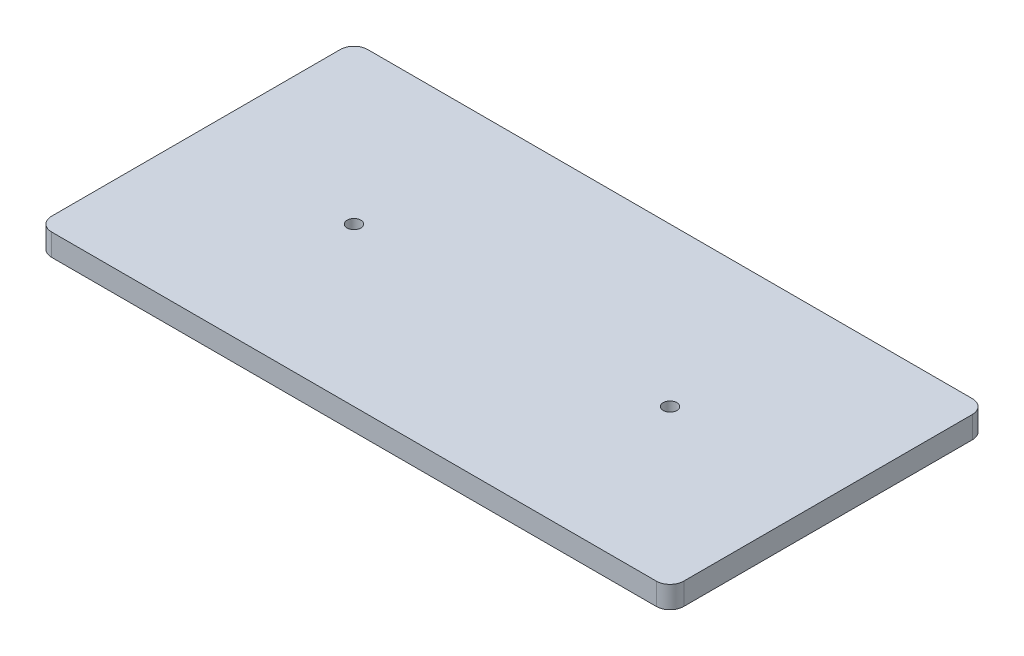
from build123d import *

# Parameters (mm, degrees)
EXTRUDE_1_DEPTH     = 8
CUT_EXTRUDE_5_REACH = 581.256
SKETCH_13_R         = 5


with BuildPart() as part:
    # 草圖1 → 填料-伸長1 (new, symmetric)
    with BuildSketch(Plane(origin=(0, 0, 0), x_dir=(1, 0, 0), z_dir=(0, 1, 0))):
        with BuildLine():
            ThreePointArc((567.5, 105), (564.571067812, 112.071067812), (557.5, 115))
            Line((557.5, 115), (117.5, 115))
            ThreePointArc((117.5, 115), (110.428932188, 112.071067812), (107.5, 105))
            Line((107.5, 105), (107.5, -105))
            ThreePointArc((107.5, -105), (110.428932188, -112.071067812), (117.5, -115))
            Line((117.5, -115), (557.5, -115))
            ThreePointArc((557.5, -115), (564.571067812, -112.071067812), (567.5, -105))
            Line((567.5, -105), (567.5, 105))
        make_face()
    extrude(amount=EXTRUDE_1_DEPTH, both=True)

    # 草圖13 → 除料-伸長5 (cut, up to next)
    with BuildSketch(Plane.XZ.offset(8), mode=Mode.PRIVATE) as cut_extrude_5_sk1:
        with Locations((222.5, 0)):
            Circle(SKETCH_13_R)
    cut_extrude_5_tool1 = extrude(cut_extrude_5_sk1.sketch, amount=-CUT_EXTRUDE_5_REACH, mode=Mode.PRIVATE) & part.part
    # 草圖13 → 除料-伸長5 (cut, up to next)
    with BuildSketch(Plane.XZ.offset(8), mode=Mode.PRIVATE) as cut_extrude_5_sk2:
        with Locations((452.5, 0)):
            Circle(SKETCH_13_R)
    cut_extrude_5_tool2 = extrude(cut_extrude_5_sk2.sketch, amount=-CUT_EXTRUDE_5_REACH, mode=Mode.PRIVATE) & part.part
    add(cut_extrude_5_tool1.solids().sort_by_distance((222.5, -8, 0))[0], mode=Mode.SUBTRACT)
    add(cut_extrude_5_tool2.solids().sort_by_distance((452.5, -8, 0))[0], mode=Mode.SUBTRACT)


solid = part.part
